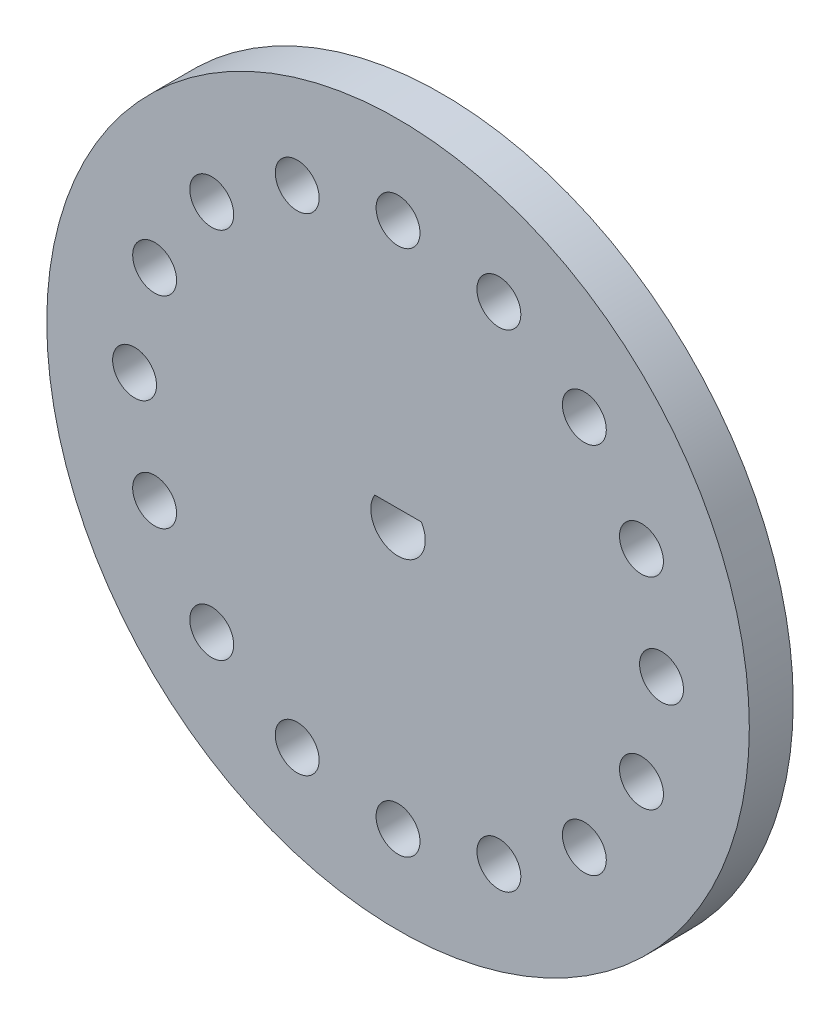
from build123d import *

# Parameters (mm, degrees)
SKETCH1_R          = 40
BASE_FLANGE1_DEPTH = 5
CUT_EXTRUDE1_REACH = 58.789
SKETCH6_R          = 2.5
CIRPATTERN1_COUNT  = 16


# Sheet-metal steps are written as plain solids
with BuildPart() as part:
    # Sketch1 → Base-Flange1 (new body)
    with BuildSketch(Plane.XY):
        Circle(SKETCH1_R)
        with BuildLine():
            Line((2.655183609, 1.6), (-2.655183609, 1.6))
            ThreePointArc((-2.655183609, 1.6), (0, -3.1), (2.655183609, 1.6))
        make_face(mode=Mode.SUBTRACT)
    extrude(amount=-BASE_FLANGE1_DEPTH)

    # Sketch6 → Cut-Extrude1 (cut, up to next)
    with BuildSketch(Plane.XY, mode=Mode.PRIVATE) as cut_extrude1_sk1:
        with Locations((0, 30)):
            Circle(SKETCH6_R)
    cut_extrude1_tool1 = extrude(cut_extrude1_sk1.sketch, amount=-CUT_EXTRUDE1_REACH, mode=Mode.PRIVATE) & part.part
    cut_extrude1 = cut_extrude1_tool1.solids().sort_by_distance((0, 30, 0))[0]
    add(cut_extrude1, mode=Mode.SUBTRACT)

    # CirPattern1: Cut-Extrude1 ×16 about axis
    cirpattern1_axis = Axis((0, 0, 0), (0, 0, 1))
    for i in range(1, CIRPATTERN1_COUNT):
        add(cut_extrude1.rotate(cirpattern1_axis, i * 360 / CIRPATTERN1_COUNT), mode=Mode.SUBTRACT)


solid = part.part
